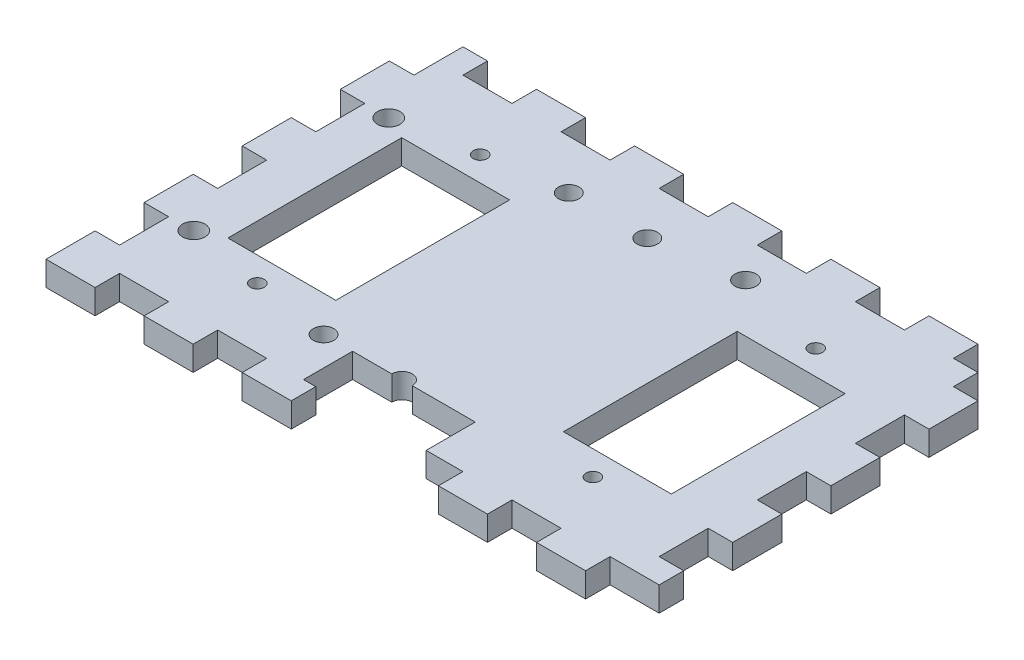
from build123d import *

# Parameters (mm, degrees)
SKETCH1_W                     = 152.4
SKETCH1_H                     = 101.6
BOSS_EXTRUDE2_DEPTH           = 6.35
SKETCH2_W                     = 6.35
SKETCH2_H                     = 12.7
CUT_EXTRUDE2_DEPTH            = 6.35
SKETCH2_4_W                   = 12.7
SKETCH2_4_H                   = 6.35
CUT_EXTRUDE3_DEPTH            = 6.35
SKETCH9_W                     = 27.94
SKETCH9_H                     = 45
CUT_EXTRUDE4_DEPTH            = 184.272045059
SKETCH12_W                    = 31.75
SKETCH12_H                    = 12.7
CUT_EXTRUDE6_DEPTH            = 184.272045059
SKETCH21_W                    = 2.9
SKETCH21_H                    = 6.35
M5_CLEARANCE_HOLE2_AT_2_COUNT = 2
M5_CLEARANCE_HOLE2_AT_2_PITCH = 50.48
SKETCH30_W                    = 2.75
SKETCH30_H                    = 6.35
M3_CLEARANCE_HOLE1_D          = 3.6
M5_CLEARANCE_HOLE4_D          = 5.3


with BuildPart() as part:
    # Sketch1 → Boss-Extrude2 (new body)
    with BuildSketch(Plane(origin=(0, 0, 0), x_dir=(1, 0, 0), z_dir=(0, 1, 0))):
        with Locations((76.2, 50.8)):
            Rectangle(SKETCH1_W, SKETCH1_H)
    extrude(amount=BOSS_EXTRUDE2_DEPTH)

    # Sketch2 → Cut-Extrude2 (cut)
    with BuildSketch(Plane(origin=(0, 6.35, 0), x_dir=(1, 0, 0), z_dir=(0, 1, 0))):
        with Locations((3.175, 95.25)):
            Rectangle(SKETCH2_W, SKETCH2_H)
        with Locations((3.175, 69.85)):
            Rectangle(SKETCH2_W, SKETCH2_H)
        with Locations((3.175, 44.45)):
            Rectangle(SKETCH2_W, SKETCH2_H)
        with Locations((3.175, 19.05)):
            Rectangle(SKETCH2_W, SKETCH2_H)
    cut_extrude2 = extrude(amount=-CUT_EXTRUDE2_DEPTH, mode=Mode.SUBTRACT)

    # Mirror1: Cut-Extrude2 across plane
    add(cut_extrude2.mirror(Plane.ZY.offset(-76.2)), mode=Mode.SUBTRACT)

    # Sketch2<4> → Cut-Extrude3 (cut)
    with BuildSketch(Plane(origin=(0, 6.35, 0), x_dir=(1, 0, 0), z_dir=(0, 1, 0))):
        with Locations((19.05, 98.425)):
            Rectangle(SKETCH2_4_W, SKETCH2_4_H)
        with Locations((44.45, 98.425)):
            Rectangle(SKETCH2_4_W, SKETCH2_4_H)
        with Locations((69.85, 98.425)):
            Rectangle(SKETCH2_4_W, SKETCH2_4_H)
        with Locations((95.25, 98.425)):
            Rectangle(SKETCH2_4_W, SKETCH2_4_H)
        with Locations((146.05, 98.425)):
            Rectangle(SKETCH2_4_W, SKETCH2_4_H)
        with Locations((120.65, 98.425)):
            Rectangle(SKETCH2_4_W, SKETCH2_4_H)
    cut_extrude3 = extrude(amount=-CUT_EXTRUDE3_DEPTH, mode=Mode.SUBTRACT)

    # Mirror2: Cut-Extrude3 across plane
    add(cut_extrude3.mirror(Plane(origin=(0, 0, -50.8), x_dir=(1, 0, 0), z_dir=(0, 0, -1))), mode=Mode.SUBTRACT)

    # Sketch9 → Cut-Extrude4 (cut, through all)
    with BuildSketch(Plane(origin=(0, 6.35, 0), x_dir=(1, 0, 0), z_dir=(0, 1, 0))):
        with Locations((32.766, 50.8)):
            Rectangle(SKETCH9_W, SKETCH9_H)
        with Locations((119.634, 50.8)):
            Rectangle(SKETCH9_W, SKETCH9_H)
    extrude(amount=-CUT_EXTRUDE4_DEPTH, mode=Mode.SUBTRACT)

    # Sketch12 → Cut-Extrude6 (cut, through all)
    with BuildSketch(Plane(origin=(0, 6.35, 0), x_dir=(1, 0, 0), z_dir=(0, 1, 0))):
        with Locations((76.2, 12.7)):
            Rectangle(SKETCH12_W, SKETCH12_H)
    extrude(amount=-CUT_EXTRUDE6_DEPTH, mode=Mode.SUBTRACT)


with BuildPart() as cut_extrude6_piece_1:
    # of the separate pieces the step leaves, piece 1, a body of its own (cut_extrude6_pieces)
    add(part.part.solids().sort_by_distance((0, 0, -88.9))[0])

    # Sketch21 → M5 Clearance Hole2 (revolve, cut)
    with BuildSketch(Plane(origin=(12.7, 0, -76.04), x_dir=(0, 0, -1), z_dir=(1, 0, 0))):
        with Locations((1.45, 3.175)):
            Rectangle(SKETCH21_W, SKETCH21_H)
    m5_clearance_hole2 = revolve(axis=Axis((12.7, -6.35, -76.04), (0, 1, 0)), mode=Mode.SUBTRACT)

    # M5 Clearance Hole2 at 2: M5 Clearance Hole2 ×2
    with Locations(*[(0, 0, i * M5_CLEARANCE_HOLE2_AT_2_PITCH) for i in range(1, M5_CLEARANCE_HOLE2_AT_2_COUNT)]):
        add(m5_clearance_hole2, mode=Mode.SUBTRACT)

    # Sketch30 → M5 Clearance Hole3 (revolve, cut)
    with BuildSketch(Plane(origin=(95.25, 0, -85.8774), x_dir=(0, 0, -1), z_dir=(1, 0, 0))):
        with Locations((1.375, 3.175)):
            Rectangle(SKETCH30_W, SKETCH30_H)
    revolve(axis=Axis((95.25, -6.35, -85.8774), (0, 1, 0)), mode=Mode.SUBTRACT)

    # M3 Clearance Hole1 (through all)
    with Locations(Plane(origin=(0, 6.35, 0), x_dir=(1, 0, 0), z_dir=(0, 1, 0))):
        with Locations((32.766, 79.65), (119.634, 79.65), (119.634, 21.95), (32.766, 21.95)):
            Hole(M3_CLEARANCE_HOLE1_D / 2)

    # M5 Clearance Hole4 (through all)
    with Locations(Plane(origin=(0, 0, 0), x_dir=(-1, 0, 0), z_dir=(0, -1, 0))):
        with Locations((-73.126, 82.55), (-52.806, 82.55), (-73.126, 19.05), (-52.806, 19.05)):
            Hole(M5_CLEARANCE_HOLE4_D / 2)


with BuildPart() as cut_extrude6_piece_2:
    # of the separate pieces the step leaves, piece 2, a body of its own (cut_extrude6_pieces)
    add(part.part.solids().sort_by_distance((88.9, 0, -6.35))[0])


solid = cut_extrude6_piece_1.part
